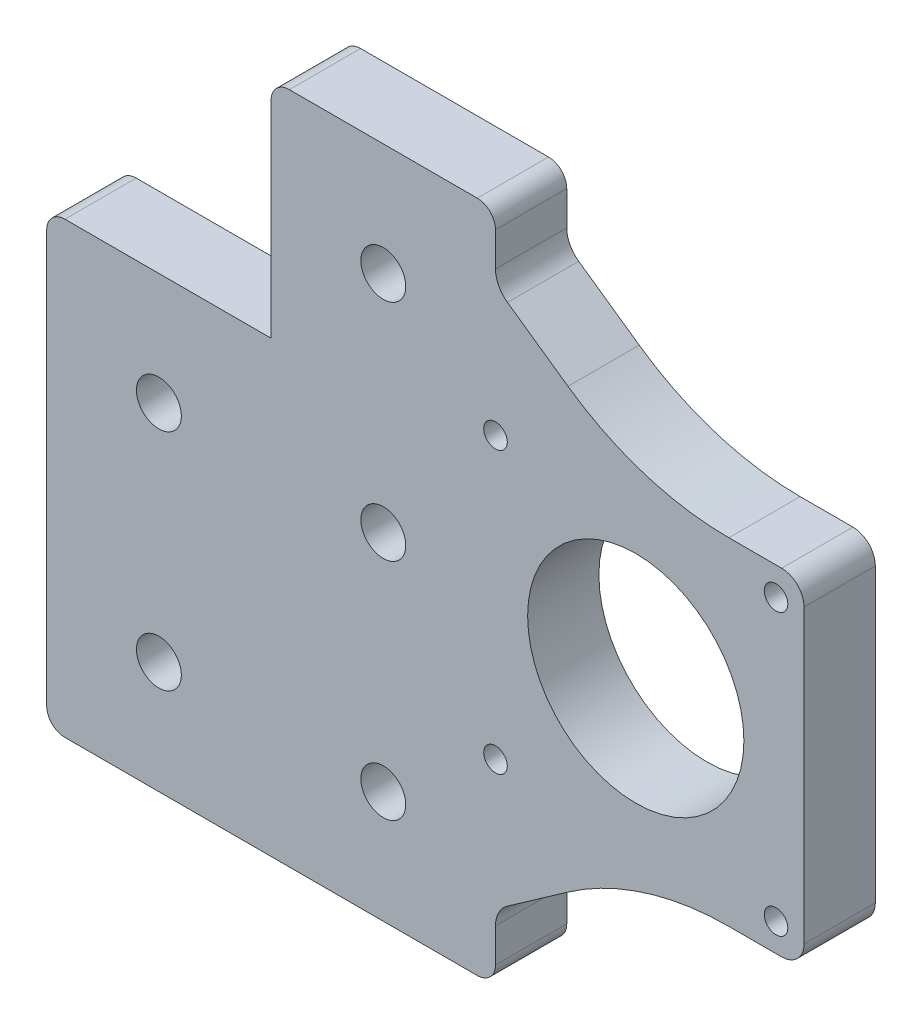
from build123d import *

# Parameters (mm, degrees)
SKETCH1_R                = 4
SKETCH1_R_2              = 13.05
BOSS_EXTRUDE1_DEPTH      = 12.7
BOSS_EXTRUDE2_START      = -3.2
SKETCH2_R                = 13.05
SKETCH2_R_2              = 10
BOSS_EXTRUDE2_DEPTH      = 3.2
FILLET1_R                = 5
FILLET2_R                = 3.25
BOSS_EXTRUDE3_START      = -12.7
BOSS_EXTRUDE3_DEPTH      = 12.7
CUT_EXTRUDE1_START       = -12.7
CUT_EXTRUDE1_OUTLINE_R   = 19.275
CUT_EXTRUDE1_OUTLINE_R_2 = 10
CUT_EXTRUDE1_DEPTH       = 12.7
FILLET3_R                = 4
FILLET4_R                = 50
M5X0_8_TAPPED_HOLE1_D    = 4.2


# Read off the part's stored shape, not the designer's step: Boss-Extrude3, Cut-Extrude1
with BuildPart() as part:
    # Sketch1 → Boss-Extrude1 (new body)
    with BuildSketch(Plane.XY):
        with BuildLine():
            Line((0, 0), (0, 11.914408096))
            Line((0, 11.914408096), (39.368089731, 39.480241291))
            ThreePointArc((39.368089731, 39.480241291), (50.05, 60), (39.368089731, 80.519758709))
            Line((39.368089731, 80.519758709), (0, 108.085591904))
            Line((0, 108.085591904), (0, 120))
            Line((0, 120), (-40, 120))
            Line((-40, 120), (-40, 80))
            Line((-40, 80), (-80, 80))
            Line((-80, 80), (-80, 0))
            Line((-80, 0), (0, 0))
        make_face()
        with Locations((-20, 20)):
            Circle(SKETCH1_R, mode=Mode.SUBTRACT)
        with Locations((-60, 20)):
            Circle(SKETCH1_R, mode=Mode.SUBTRACT)
        with Locations((-60, 60)):
            Circle(SKETCH1_R, mode=Mode.SUBTRACT)
        with Locations((-20, 60)):
            Circle(SKETCH1_R, mode=Mode.SUBTRACT)
        with Locations((-20, 100)):
            Circle(SKETCH1_R, mode=Mode.SUBTRACT)
        with Locations((25, 60)):
            Circle(SKETCH1_R_2, mode=Mode.SUBTRACT)
    extrude(amount=BOSS_EXTRUDE1_DEPTH)

    # Sketch2 → Boss-Extrude2 (add)
    with BuildSketch(Plane.XY.offset(12.7).offset(BOSS_EXTRUDE2_START)):
        with Locations((25, 60)):
            Circle(SKETCH2_R)
        with Locations((25, 60)):
            Circle(SKETCH2_R_2, mode=Mode.SUBTRACT)
    extrude(amount=BOSS_EXTRUDE2_DEPTH)

    # Fillet1
    fillet1_edges = [part.edges().sort_by_distance(p)[0] for p in [
        (0, 108.085591904, 6.35),
        (0, 11.914408096, 6.35),
    ]]
    fillet(fillet1_edges, radius=FILLET1_R)

    # Fillet2
    fillet2_edges = [part.edges().sort_by_distance(p)[0] for p in [
        (-80, 0, 6.35),
        (-80, 80, 6.35),
        (-40, 120, 6.35),
        (0, 120, 6.35),
        (0, 0, 6.35),
    ]]
    fillet(fillet2_edges, radius=FILLET2_R)

    # Boss-Extrude3 outline → Boss-Extrude3 (add)
    with BuildSketch(Plane(origin=(0, 0, 0), x_dir=(-1, 0, 0), z_dir=(0, 0, -1)).offset(BOSS_EXTRUDE3_START)):
        with BuildLine():
            Line((-55, 90), (-55, 30))
            Line((-55, 30), (-25.828902028, 30))
            Line((-25.828902028, 30), (-39.368089731, 39.480241291))
            ThreePointArc((-39.368089731, 39.480241291), (-50.05, 60), (-39.368089731, 80.519758709))
            Line((-39.368089731, 80.519758709), (-25.828902028, 90))
            Line((-25.828902028, 90), (-55, 90))
        make_face()
    extrude(amount=BOSS_EXTRUDE3_DEPTH)

    # Cut-Extrude1 outline → Cut-Extrude1 (cut)
    with BuildSketch(Plane(origin=(0, 0, 0), x_dir=(-1, 0, 0), z_dir=(0, 0, -1)).offset(CUT_EXTRUDE1_START)):
        with Locations((-25, 60)):
            Circle(CUT_EXTRUDE1_OUTLINE_R)
        with Locations((-25, 60)):
            Circle(CUT_EXTRUDE1_OUTLINE_R_2, mode=Mode.SUBTRACT)
    extrude(amount=CUT_EXTRUDE1_DEPTH, mode=Mode.SUBTRACT)

    # Fillet3
    fillet3_edges = [part.edges().sort_by_distance(p)[0] for p in [
        (55, 90, 6.35),
        (55, 30, 6.35),
    ]]
    fillet(fillet3_edges, radius=FILLET3_R)

    # Fillet4
    fillet4_edges = [part.edges().sort_by_distance(p)[0] for p in [
        (25.828902028, 30, 6.35),
        (25.828902028, 90, 6.35),
    ]]
    fillet(fillet4_edges, radius=FILLET4_R)

    # M5x0.8 Tapped Hole1 (through all)
    with Locations(Plane(origin=(0, 0, 0), x_dir=(-1, 0, 0), z_dir=(0, 0, -1))):
        with Locations((0, 85), (0, 35), (-50, 85), (-50, 35)):
            Hole(M5X0_8_TAPPED_HOLE1_D / 2)


solid = part.part
